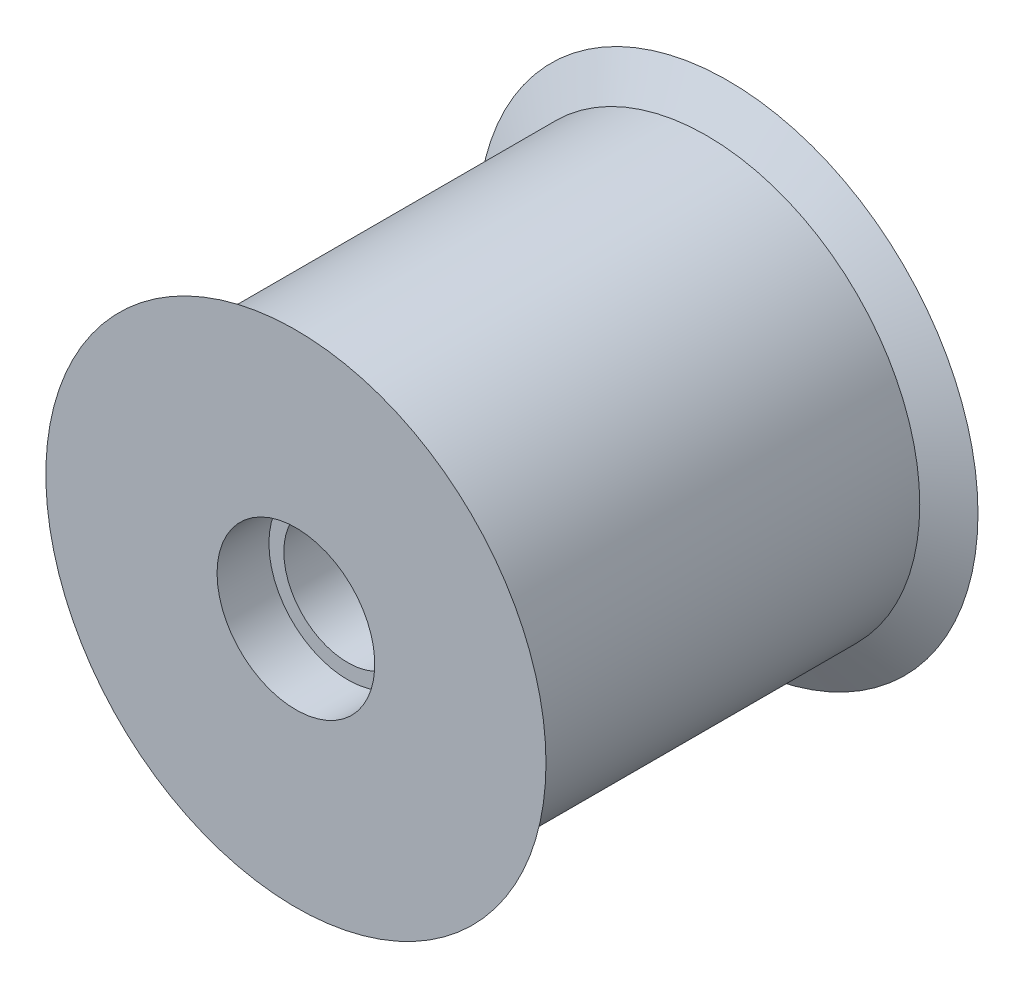
from build123d import *

# Parameters (mm, degrees)
CHAMFER1_SIZE   = 3.464101615
CHAMFER1_SIZE_2 = 6


with BuildPart() as part:
    # Sketch1 → Revolve1 (revolve)
    with BuildSketch(Plane(origin=(0, 0, 0), x_dir=(1, 0, 0), z_dir=(0, 1, 0)), mode=Mode.PRIVATE) as revolve1_sk:
        Polygon((0, 0), (0, 60.8), (-36, 60.8), (-36, 57.8), (-30, 57.8), (-30, 3), (-36, 3), (-36, 0), align=None)
    revolve(revolve1_sk.sketch.rotate(Axis((0, 0, 0), (0, 0, -1)), 180), axis=Axis((0, 0, 0), (0, 0, -1)))

    # Sketch7 → Cut-Revolve1 (revolve, cut)
    with BuildSketch(Plane(origin=(0, 0, 0), x_dir=(1, 0, 0), z_dir=(0, 1, 0))):
        Polygon((0, 60.8), (-11.1, 60.8), (-11.1, 53.5), (-9, 53.5), (-9, 7.3), (-11.1, 7.3), (-11.1, 0), (0, 0), align=None)
    revolve(axis=Axis((0, 0, -60.8), (0, 0, 1)), mode=Mode.SUBTRACT)

    # Chamfer1
    # the kernel refuses this chamfer: 6, 3.464101615 mm, written as the material it takes off along each edge
    with BuildSketch(Plane(origin=(0, 0, -57.8), x_dir=(1, 0, 0), z_dir=(0, 1, 0))) as chamfer1_piece_1_section:
        Polygon((36, CHAMFER1_SIZE), (36 - CHAMFER1_SIZE_2, 0), (36, 0), align=None)
    chamfer1_piece_1 = revolve(axis=Axis((0, 0, -57.8), (0, 0, -1)), mode=Mode.PRIVATE)
    chamfer1_piece_1 = chamfer1_piece_1 - Plane(origin=(0, 0, -57.8), x_dir=(1, 0, 0), z_dir=(0, 0, 1)) * Cylinder(30, 144, mode=Mode.PRIVATE)
    add(chamfer1_piece_1, mode=Mode.SUBTRACT)
    with BuildSketch(Plane(origin=(0, 0, -3), x_dir=(1, 0, 0), z_dir=(0, 1, 0))) as chamfer1_piece_2_section:
        Polygon((36 - CHAMFER1_SIZE_2, 0), (36, -CHAMFER1_SIZE), (36, 0), align=None)
    chamfer1_piece_2 = revolve(axis=Axis((0, 0, -3), (0, 0, -1)), mode=Mode.PRIVATE)
    chamfer1_piece_2 = chamfer1_piece_2 - Plane(origin=(0, 0, -3), x_dir=(1, 0, 0), z_dir=(0, 0, 1)) * Cylinder(30, 144, mode=Mode.PRIVATE)
    add(chamfer1_piece_2, mode=Mode.SUBTRACT)


solid = part.part
